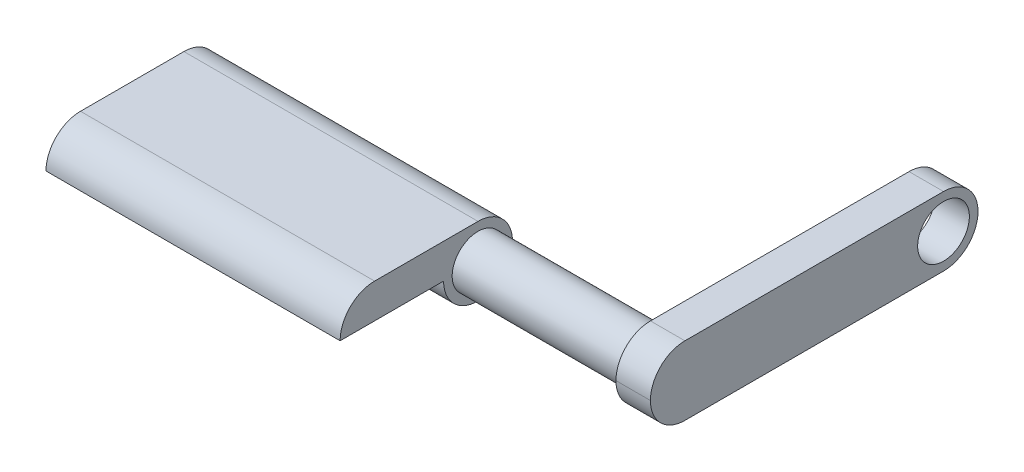
from build123d import *

# Parameters (mm, degrees)
SKETCH2_R           = 2
BOSS_EXTRUDE1_DEPTH = 17.06
SKETCH3_R           = 1.5
BOSS_EXTRUDE2_DEPTH = 12
SKETCH4_W           = 3.988125856
SKETCH4_H           = 4
BOSS_EXTRUDE3_DEPTH = 2
SKETCH5_W           = 2
SKETCH5_H           = 4
BOSS_EXTRUDE4_DEPTH = 19
FILLET1_R           = 2
FILLET2_R           = 2
FILLET3_R           = 2
SKETCH6_R           = 1.5
CUT_EXTRUDE1_DEPTH  = 34.726600777
SKETCH10_W          = 8
SKETCH10_H          = 2
BOSS_EXTRUDE8_DEPTH = 17.06
FILLET6_R           = 2


with BuildPart() as part:
    # Sketch2 → Boss-Extrude1 (new body)
    with BuildSketch(Plane(origin=(0, 0, 0), x_dir=(0, 0, -1), z_dir=(1, 0, 0))):
        Circle(SKETCH2_R)
    extrude(amount=BOSS_EXTRUDE1_DEPTH)

    # Sketch3 → Boss-Extrude2 (add)
    with BuildSketch(Plane(origin=(17.06, 0, 0), x_dir=(0, 0, -1), z_dir=(1, 0, 0))):
        Circle(SKETCH3_R)
    extrude(amount=BOSS_EXTRUDE2_DEPTH)

    # Sketch4 → Boss-Extrude3 (add)
    with BuildSketch(Plane(origin=(29.06, 0, 0), x_dir=(0, 0, -1), z_dir=(1, 0, 0))):
        with Locations((-0.005937072, 0)):
            Rectangle(SKETCH4_W, SKETCH4_H)
    extrude(amount=-BOSS_EXTRUDE3_DEPTH)

    # Sketch5 → Boss-Extrude4 (add)
    with BuildSketch(Plane.XY.offset(2)):
        with Locations((28.06, 0)):
            Rectangle(SKETCH5_W, SKETCH5_H)
    extrude(amount=-BOSS_EXTRUDE4_DEPTH)

    # Fillet1
    fillet1_edges = [part.edges().sort_by_distance(p)[0] for p in [
        (28.06, 2, 2),
    ]]
    fillet(fillet1_edges, radius=FILLET1_R)

    # Fillet2
    fillet2_edges = [part.edges().sort_by_distance(p)[0] for p in [
        (28.06, -2, 2),
    ]]
    fillet(fillet2_edges, radius=FILLET2_R - 0.0001)  # a hair under: the kernel refuses the full size

    # Fillet3
    fillet3_edges = [part.edges().sort_by_distance(p)[0] for p in [
        (28.06, -2, -17),
        (28.06, 2, -17),
    ]]
    fillet(fillet3_edges, radius=FILLET3_R - 0.0001)  # a hair under: the kernel refuses the full size

    # Sketch6 → Cut-Extrude1 (cut, through all)
    with BuildSketch(Plane(origin=(29.06, 0, 0), x_dir=(0, 0, -1), z_dir=(1, 0, 0))):
        with Locations((15, 0)):
            Circle(SKETCH6_R)
    extrude(amount=-CUT_EXTRUDE1_DEPTH, mode=Mode.SUBTRACT)

    # Sketch10 → Boss-Extrude8 (add)
    with BuildSketch(Plane.ZY):
        with Locations((4, 1)):
            Rectangle(SKETCH10_W, SKETCH10_H)
    extrude(amount=-BOSS_EXTRUDE8_DEPTH)

    # Fillet6
    fillet6_edges = [part.edges().sort_by_distance(p)[0] for p in [
        (8.53, 2, 8),
    ]]
    fillet(fillet6_edges, radius=FILLET6_R - 0.0001)  # a hair under: the kernel refuses the full size


solid = part.part
